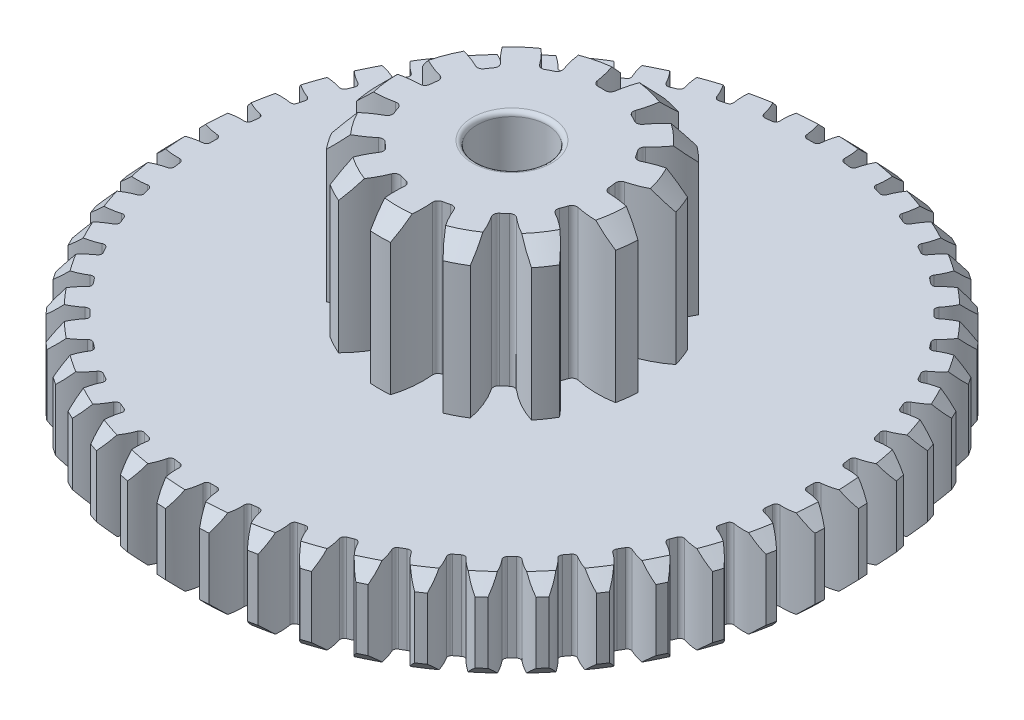
from build123d import *

# Parameters (mm, degrees)
SKETCH2_R                = 3
BOSS_EXTRUDE1_DEPTH      = 3.4
CUT_EXTRUDE1_DEPTH       = 6.436910888
FILLET1_R                = 0.12
CHAMFER1_SIZE            = 0.4
CIRPATTERN1_COUNT        = 13
FILLET1_OF_CIRPATTERN1_R = 0.12
SKETCH4_R                = 7.5
BOSS_EXTRUDE3_DEPTH      = 2
CUT_EXTRUDE2_REACH       = 13.902
FILLET2_R                = 0.09
CHAMFER2_SIZE            = 0.3
CIRPATTERN2_COUNT        = 48
FILLET2_OF_CIRPATTERN2_R = 0.09
SKETCH8_R                = 0.8
CUT_EXTRUDE3_DEPTH       = 12.889517946
FILLET3_R                = 0.1


with BuildPart() as part:
    # Sketch2 → Boss-Extrude1 (new body)
    with BuildSketch(Plane(origin=(0, 0, 0), x_dir=(1, 0, 0), z_dir=(0, 1, 0))):
        Circle(SKETCH2_R)
    extrude(amount=BOSS_EXTRUDE1_DEPTH)

    # Sketch3 → Cut-Extrude1 (cut, through all)
    with BuildSketch(Plane(origin=(0, 3.4, 0), x_dir=(1, 0, 0), z_dir=(0, 1, 0))):
        with BuildLine():
            ThreePointArc((-0.493265204, 2.959170397), (-0.289597906, 2.512142796), (-0.18978463, 2.031152824))
            ThreePointArc((-0.18978463, 2.031152824), (0, 2.04), (0.18978463, 2.031152824))
            ThreePointArc((0.18978463, 2.031152824), (0.289597906, 2.512142796), (0.493265204, 2.959170397))
            ThreePointArc((0.493265204, 2.959170397), (0, 3), (-0.493265204, 2.959170397))
        make_face()
    cut_extrude1 = extrude(amount=-CUT_EXTRUDE1_DEPTH, mode=Mode.SUBTRACT)

    # Fillet1
    fillet1_edges = [part.edges().sort_by_distance(p)[0] for p in [
        (-0.18978463, 1.7, -2.031152824),
        (0.18978463, 1.7, -2.031152824),
    ]]
    fillet(fillet1_edges, radius=FILLET1_R)

    # Chamfer1
    chamfer1_edges = [part.edges().sort_by_distance(p)[0] for p in [
        (0, 3.4, 3),
    ]]
    chamfer(chamfer1_edges, length=CHAMFER1_SIZE)

    # CirPattern1: Cut-Extrude1 ×13 about axis
    cirpattern1_axis = Axis((0, 3.4, 0), (0, -1, 0))
    for i in range(1, CIRPATTERN1_COUNT):
        add(cut_extrude1.rotate(cirpattern1_axis, i * 360 / CIRPATTERN1_COUNT), mode=Mode.SUBTRACT)

    # Fillet1 of CirPattern1
    fillet1_of_cirpattern1_edges = [part.edges().sort_by_distance(p)[0] for p in [
        (0.775877839, 1.7, -1.886693822),
        (1.111969728, 1.7, -1.710299192),
        (1.563796045, 1.7, -1.310016003),
        (1.779415961, 1.7, -0.997636626),
        (1.993467424, 1.7, -0.433229305),
        (2.039219442, 1.7, -0.056427532),
        (1.966459439, 1.7, 0.542805006),
        (1.831862324, 1.7, 0.897708429),
        (1.488959295, 1.7, 1.394489231),
        (1.204847624, 1.7, 1.646190208),
        (0.670356521, 1.7, 1.92671278),
        (0.301816854, 1.7, 2.017549649),
        (-0.301816854, 1.7, 2.017549649),
        (-0.670356521, 1.7, 1.92671278),
        (-1.204847624, 1.7, 1.646190208),
        (-1.488959295, 1.7, 1.394489231),
        (-1.831862324, 1.7, 0.897708429),
        (-1.966459439, 1.7, 0.542805006),
        (-2.039219442, 1.7, -0.056427532),
        (-1.993467424, 1.7, -0.433229305),
        (-1.779415961, 1.7, -0.997636626),
        (-1.563796045, 1.7, -1.310016003),
        (-1.111969728, 1.7, -1.710299192),
        (-0.775877839, 1.7, -1.886693822),
    ]]
    fillet(fillet1_of_cirpattern1_edges, radius=FILLET1_OF_CIRPATTERN1_R)

    # Sketch4 → Boss-Extrude3 (add)
    with BuildSketch(Plane.XZ):
        Circle(SKETCH4_R)
    extrude(amount=BOSS_EXTRUDE3_DEPTH)

    # Sketch7 → Cut-Extrude2 (cut, up to next)
    with BuildSketch(Plane.XZ.offset(2), mode=Mode.PRIVATE) as cut_extrude2_sk1:
        with BuildLine():
            ThreePointArc((-0.156882898, 6.778184695), (-0.220024737, 7.150857077), (-0.38688957, 7.49001445))
            ThreePointArc((-0.38688957, 7.49001445), (0, 7.5), (0.38688957, 7.49001445))
            ThreePointArc((0.38688957, 7.49001445), (0.220024737, 7.150857077), (0.156882898, 6.778184695))
            ThreePointArc((0.156882898, 6.778184695), (0, 6.78), (-0.156882898, 6.778184695))
        make_face()
    cut_extrude2_tool1 = extrude(cut_extrude2_sk1.sketch, amount=-CUT_EXTRUDE2_REACH, mode=Mode.PRIVATE) & part.part
    cut_extrude2 = cut_extrude2_tool1.solids().sort_by_distance((0, -2, 7.196505))[0]
    add(cut_extrude2, mode=Mode.SUBTRACT)

    # Fillet2
    fillet2_edges = [part.edges().sort_by_distance(p)[0] for p in [
        (0.156882898, -1, 6.778184695),
        (-0.156882898, -1, 6.778184695),
    ]]
    fillet(fillet2_edges, radius=FILLET2_R)

    # Chamfer2
    chamfer2_edges = [part.edges().sort_by_distance(p)[0] for p in [
        (-5.164703681, 0, -5.438367024),
        (-5.164703681, -2, -5.438367024),
    ]]
    chamfer(chamfer2_edges, length=CHAMFER2_SIZE)

    # CirPattern2: Cut-Extrude2 ×48 about axis
    cirpattern2_axis = Axis((0, -2, 0), (0, 1, 0))
    for i in range(1, CIRPATTERN2_COUNT):
        add(cut_extrude2.rotate(cirpattern2_axis, i * 360 / CIRPATTERN2_COUNT), mode=Mode.SUBTRACT)

    # Fillet2 of CirPattern2
    fillet2_of_cirpattern2_edges = [part.edges().sort_by_distance(p)[0] for p in [
        (1.040271382, -1, 6.699719058),
        (0.729189895, -1, 6.740673712),
        (1.905860533, -1, 6.50661937),
        (1.602786047, -1, 6.587827934),
        (2.738839883, -1, 6.202189621),
        (2.448958086, -1, 6.322262593),
        (3.524956923, -1, 5.791638688),
        (3.253227772, -1, 5.948521586),
        (4.250760972, -1, 5.281991211),
        (4.00183383, -1, 5.472999726),
        (4.903833323, -1, 4.681967401),
        (4.681967401, -1, 4.903833323),
        (5.472999726, -1, 4.00183383),
        (5.281991211, -1, 4.250760972),
        (5.948521586, -1, 3.253227772),
        (5.791638688, -1, 3.524956923),
        (6.322262593, -1, 2.448958086),
        (6.202189621, -1, 2.738839883),
        (6.587827934, -1, 1.602786047),
        (6.50661937, -1, 1.905860533),
        (6.740673712, -1, 0.729189895),
        (6.699719058, -1, 1.040271382),
        (6.778184695, -1, -0.156882898),
        (6.778184695, -1, 0.156882898),
        (6.699719058, -1, -1.040271382),
        (6.740673712, -1, -0.729189895),
        (6.50661937, -1, -1.905860533),
        (6.587827934, -1, -1.602786047),
        (6.202189621, -1, -2.738839883),
        (6.322262593, -1, -2.448958086),
        (5.791638688, -1, -3.524956923),
        (5.948521586, -1, -3.253227772),
        (5.281991211, -1, -4.250760972),
        (5.472999726, -1, -4.00183383),
        (4.681967401, -1, -4.903833323),
        (4.903833323, -1, -4.681967401),
        (4.00183383, -1, -5.472999726),
        (4.250760972, -1, -5.281991211),
        (3.253227772, -1, -5.948521586),
        (3.524956923, -1, -5.791638688),
        (2.448958086, -1, -6.322262593),
        (2.738839883, -1, -6.202189621),
        (1.602786047, -1, -6.587827934),
        (1.905860533, -1, -6.50661937),
        (0.729189895, -1, -6.740673712),
        (1.040271382, -1, -6.699719058),
        (-0.156882898, -1, -6.778184695),
        (0.156882898, -1, -6.778184695),
        (-1.040271382, -1, -6.699719058),
        (-0.729189895, -1, -6.740673712),
        (-1.905860533, -1, -6.50661937),
        (-1.602786047, -1, -6.587827934),
        (-2.738839883, -1, -6.202189621),
        (-2.448958086, -1, -6.322262593),
        (-3.524956923, -1, -5.791638688),
        (-3.253227772, -1, -5.948521586),
        (-4.250760972, -1, -5.281991211),
        (-4.00183383, -1, -5.472999726),
        (-4.903833323, -1, -4.681967401),
        (-4.681967401, -1, -4.903833323),
        (-5.472999726, -1, -4.00183383),
        (-5.281991211, -1, -4.250760972),
        (-5.948521586, -1, -3.253227772),
        (-5.791638688, -1, -3.524956923),
        (-6.322262593, -1, -2.448958086),
        (-6.202189621, -1, -2.738839883),
        (-6.587827934, -1, -1.602786047),
        (-6.50661937, -1, -1.905860533),
        (-6.740673712, -1, -0.729189895),
        (-6.699719058, -1, -1.040271382),
        (-6.778184695, -1, 0.156882898),
        (-6.778184695, -1, -0.156882898),
        (-6.699719058, -1, 1.040271382),
        (-6.740673712, -1, 0.729189895),
        (-6.50661937, -1, 1.905860533),
        (-6.587827934, -1, 1.602786047),
        (-6.202189621, -1, 2.738839883),
        (-6.322262593, -1, 2.448958086),
        (-5.791638688, -1, 3.524956923),
        (-5.948521586, -1, 3.253227772),
        (-5.281991211, -1, 4.250760972),
        (-5.472999726, -1, 4.00183383),
        (-4.681967401, -1, 4.903833323),
        (-4.903833323, -1, 4.681967401),
        (-4.00183383, -1, 5.472999726),
        (-4.250760972, -1, 5.281991211),
        (-3.253227772, -1, 5.948521586),
        (-3.524956923, -1, 5.791638688),
        (-2.448958086, -1, 6.322262593),
        (-2.738839883, -1, 6.202189621),
        (-1.602786047, -1, 6.587827934),
        (-1.905860533, -1, 6.50661937),
        (-0.729189895, -1, 6.740673712),
        (-1.040271382, -1, 6.699719058),
    ]]
    fillet(fillet2_of_cirpattern2_edges, radius=FILLET2_OF_CIRPATTERN2_R)

    # Sketch8 → Cut-Extrude3 (cut, through all)
    with BuildSketch(Plane(origin=(0, 3.4, 0), x_dir=(1, 0, 0), z_dir=(0, 1, 0))):
        Circle(SKETCH8_R)
    extrude(amount=-CUT_EXTRUDE3_DEPTH, mode=Mode.SUBTRACT)

    # Fillet3
    fillet3_edges = [part.edges().sort_by_distance(p)[0] for p in [
        (-0.8, 3.4, 0),
    ]]
    fillet(fillet3_edges, radius=FILLET3_R)


solid = part.part
